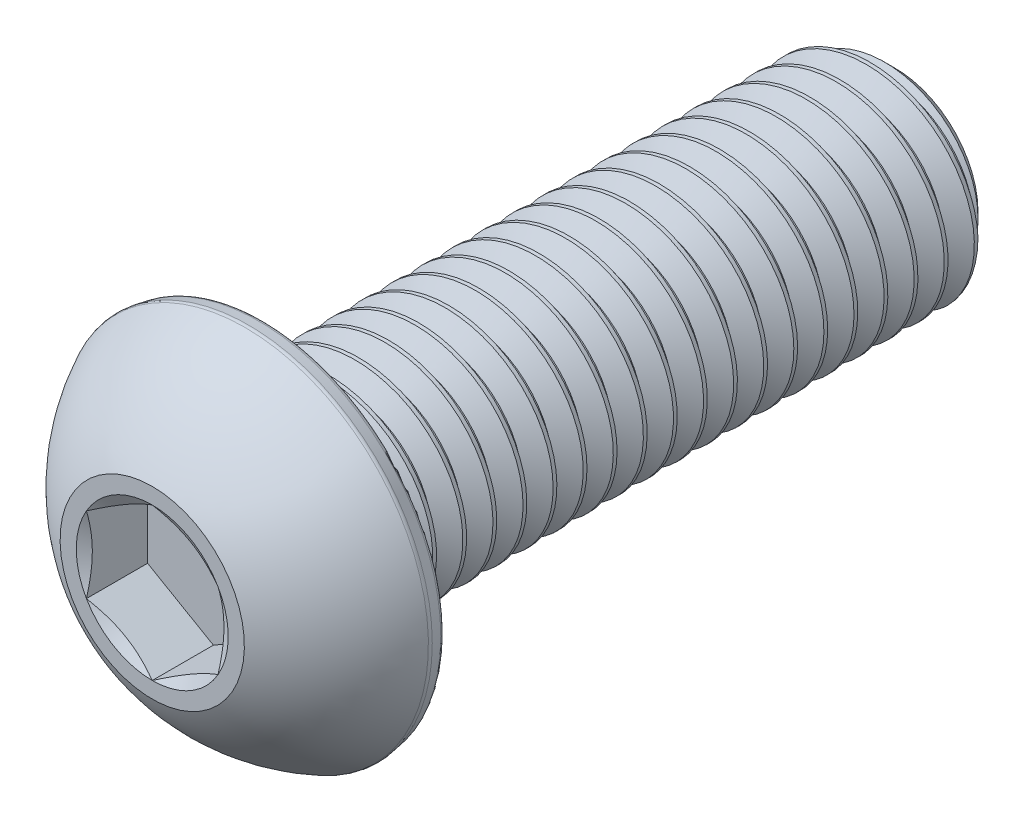
from build123d import *

# Parameters (mm, degrees)
CUT_EXTRUDE1_DEPTH = 1.84404
FILLET1_R          = 0.16764
CUT_SWEEP1_PITCH   = 0.907142857
CUT_SWEEP1_TO      = 19.05


with BuildPart() as part:
    # Sketch3 → Revolve1 (revolve)
    with BuildSketch(Plane(origin=(0, 0, 0), x_dir=(0, 0, -1), z_dir=(1, 0, 0)), mode=Mode.PRIVATE) as revolve1_sk:
        with BuildLine():
            Line((-11.2014, 0), (-11.2014, 2.778125))
            ThreePointArc((-11.2014, 2.778125), (-10.007024687, 4.401074199), (-8.35152, 5.5499))
            Line((-8.35152, 5.5499), (-7.8486, 5.461221635))
            Line((-7.8486, 5.461221635), (-7.8486, 3.175))
            Line((-7.8486, 3.175), (10.521042857, 3.175))
            Line((10.521042857, 3.175), (11.2014, 2.494642857))
            Line((11.2014, 2.494642857), (11.2014, 0))
            Line((11.2014, 0), (-11.2014, 0))
        make_face()
    revolve(revolve1_sk.sketch.rotate(Axis((0, 0, 11.2014), (0, 0, -1)), 90), axis=Axis((0, 0, 11.2014), (0, 0, -1)))

    # Sketch4 → Cut-Extrude1 (cut)
    with BuildSketch(Plane.XY.offset(11.2014)):
        Polygon((-1.984375, -1.14567944), (0, -2.291358881), (1.984375, -1.14567944), (1.984375, 1.14567944), (0, 2.291358881), (-1.984375, 1.14567944), align=None)
    extrude(amount=-CUT_EXTRUDE1_DEPTH, mode=Mode.SUBTRACT)

    # Cut-Extrude2 cone 1 section (through the dimple's axis) → Cut-Extrude2 (revolve, cut)
    with BuildSketch(Plane(origin=(0, 0, 11.2014), x_dir=(0, -1, 0), z_dir=(1, 0, 0))):
        Polygon((0, 0), (2.291358881, 0), (0, 1.322916667), align=None)
    revolve(axis=Axis((0, 0, 11.2014), (0, 0, -1)), mode=Mode.SUBTRACT)

    # Fillet1
    fillet1_edges = [part.edges().sort_by_distance(p)[0] for p in [
        (-5.461221635, 0, 7.8486),
        (-5.5499, 0, 8.35152),
    ]]
    fillet(fillet1_edges, radius=FILLET1_R)


with BuildPart() as body_2:
    # Split1: read off the stored shape, not the designer's step
    # Split1: the piece on the far side of the plane
    add(part.part)
    split(bisect_by=Plane.XY.offset(7.8486), keep=Keep.BOTTOM)

    # Cut-Sweep1: arcs per turn and ends read off the stored shape
    # Cut-Sweep1: the profile of Sketch7 screwed along a right-hand helix through 22 turns, 8 arcs to a turn; built about Z, then put on its axis
    cut_sweep1_z = Axis((0, 0, 0), (0, 0, 1))
    cut_sweep1_corners = [(3.224100547, 0, 0.028348214), (3.224100547, 0, -0.822098214), (2.585793431, 0, -0.453571429), (2.585793431, 0, -0.340178571)]
    with BuildLine(mode=Mode.PRIVATE) as cut_sweep1_profile:
        Line(cut_sweep1_corners[0], cut_sweep1_corners[1])
        Line(cut_sweep1_corners[1], cut_sweep1_corners[2])
        Line(cut_sweep1_corners[2], cut_sweep1_corners[3])
        Line(cut_sweep1_corners[3], cut_sweep1_corners[0])
    cut_sweep1_cap = Face(cut_sweep1_profile.wire())
    cut_sweep1_turn_angles = [0, 22.5, 45, 67.5, 90, 112.5, 135, 157.5, 180, 202.5, 225, 247.5, 270, 292.5, 315, 337.5, 360]
    cut_sweep1_turn_weights = [1, 0.9238795325112867, 1, 0.9238795325112867, 1, 0.9238795325112867, 1, 0.9238795325112867, 1, 0.9238795325112867, 1, 0.9238795325112867, 1, 0.9238795325112867, 1, 0.9238795325112867, 1]
    cut_sweep1_turn_rails = [Edge.make_bspline([Vector(p[0], p[1], 0).rotate(cut_sweep1_z, cut_sweep1_turn_angles[k]) / cut_sweep1_turn_weights[k] + Vector(0, 0, p[2] + CUT_SWEEP1_PITCH * cut_sweep1_turn_angles[k] / 360) for k in range(17)], [0, 0, 0, 1, 1, 2, 2, 3, 3, 4, 4, 5, 5, 6, 6, 7, 7, 8, 8, 8], 2, cut_sweep1_turn_weights) for p in cut_sweep1_corners]
    cut_sweep1_turn_sides = [Face.make_surface_from_curves(cut_sweep1_turn_rails[p[0]], cut_sweep1_turn_rails[p[1]]) for p in [(0, 1), (1, 2), (2, 3), (3, 0)]]
    cut_sweep1 = Plane(origin=(0, 0, -11.2014), x_dir=(0, 1, 0), z_dir=(0, 0, 1)) * split(Solid(Shell([*[p.moved(Location((0, 0, CUT_SWEEP1_PITCH * i))) for i in range(22) for p in cut_sweep1_turn_sides], cut_sweep1_cap, cut_sweep1_cap.rotate(cut_sweep1_z, 7920).moved(Location((0, 0, CUT_SWEEP1_PITCH * 7920 / 360)))])), bisect_by=Plane.XY.offset(CUT_SWEEP1_TO), keep=Keep.BOTTOM, mode=Mode.PRIVATE)
    add(cut_sweep1, mode=Mode.SUBTRACT)


with BuildPart() as part_1:
    add(part.part)

    # Split1
    split(bisect_by=Plane.XY.offset(7.8486), keep=Keep.TOP)

    add(body_2.part)  # Boss-Extrude1 merges body 2
    # Boss-Extrude1: read off the stored shape, not the designer's step
    # Boss-Extrude1 outline → Boss-Extrude1 (revolve)
    with BuildSketch(Plane.XZ):
        Polygon((2.585788069, 7.8486), (2.585788069, 7.161186974), (3.273201095, 7.8486), align=None)
    revolve(axis=Axis((0, 0, 0), (0, 0, 1)))


solid = part_1.part
